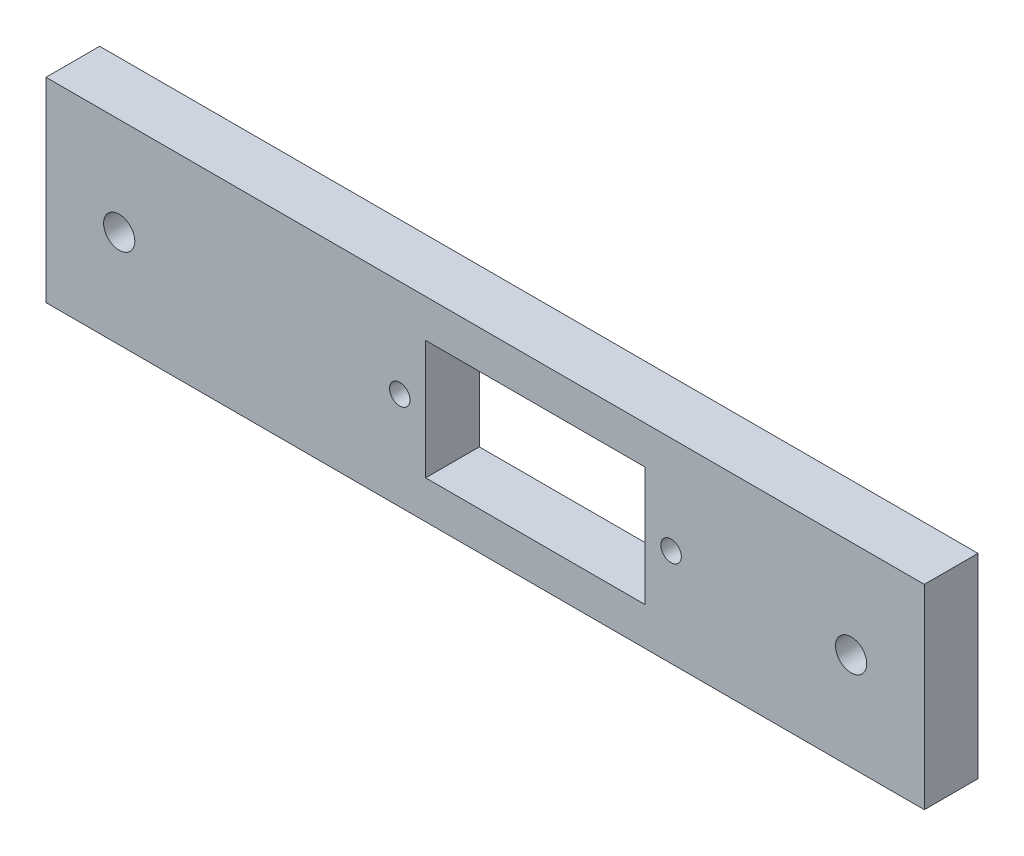
from build123d import *

# Parameters (mm, degrees)
SKETCH_1_W          = 90
SKETCH_1_H          = 20
EXTRUDE_1_DEPTH     = 5.5
SKETCH_2_R          = 1.6
SKETCH_2_R_2        = 1.05
SKETCH_2_W          = 22.5
SKETCH_2_H          = 12.2
CUT_EXTRUDE_1_DEPTH = 47.424670166


with BuildPart() as part:
    # ｽｹｯﾁ1 → ﾎﾞｽ - 押し出し1 (new body)
    with BuildSketch(Plane.XY):
        Rectangle(SKETCH_1_W, SKETCH_1_H)
    extrude(amount=EXTRUDE_1_DEPTH)

    # ｽｹｯﾁ2 → ｶｯﾄ - 押し出し1 (cut, through all)
    with BuildSketch(Plane.XY.offset(5.5)):
        with Locations((-37.5, 0)):
            Circle(SKETCH_2_R)
        with Locations((37.5, 0)):
            Circle(SKETCH_2_R)
        with Locations((-8.75, 0)):
            Circle(SKETCH_2_R_2)
        with Locations((19.05, 0)):
            Circle(SKETCH_2_R_2)
        with Locations((5.15, 0)):
            Rectangle(SKETCH_2_W, SKETCH_2_H)
    extrude(amount=-CUT_EXTRUDE_1_DEPTH, mode=Mode.SUBTRACT)


solid = part.part
